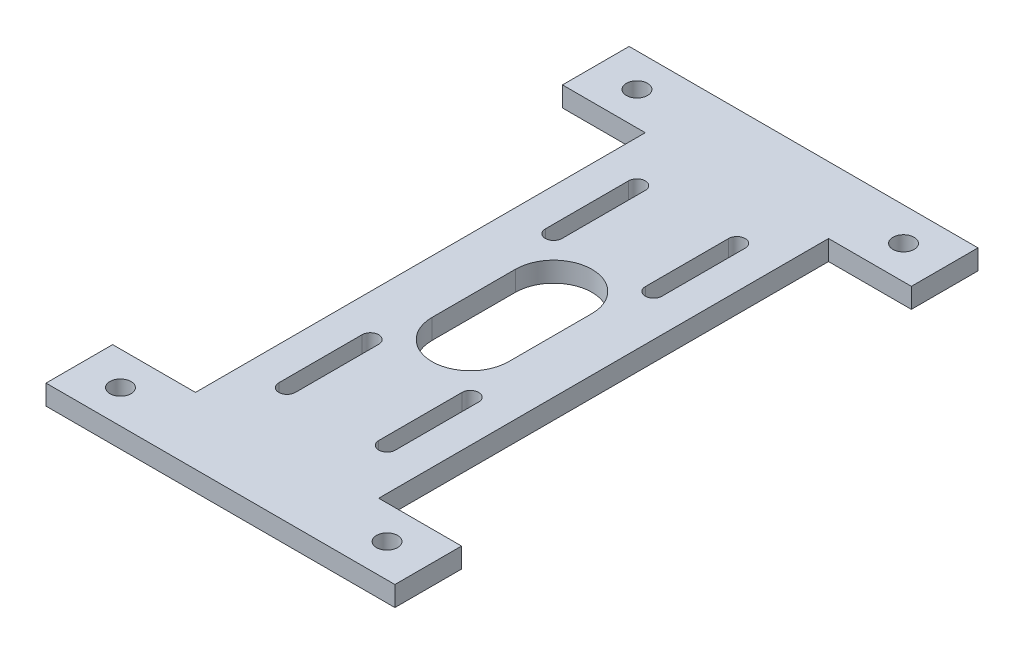
from build123d import *

# Parameters (mm, degrees)
SKETCH1_R           = 3.175
BOSS_EXTRUDE1_DEPTH = 6
SKETCH2_R           = 6
CUT_EXTRUDE1_DEPTH  = 1.5


with BuildPart() as part:
    # Sketch1 → Boss-Extrude1 (new body)
    with BuildSketch(Plane(origin=(0, 0, 0), x_dir=(1, 0, 0), z_dir=(0, 1, 0))):
        Polygon((-52.3534233, 67.5), (-27.5, 67.5), (-27.5, -67.5), (-52.3534233, -67.5), (-52.3534233, -87.5), (52.3534233, -87.5), (52.3534233, -67.5), (27.5, -67.5), (27.5, 67.5), (52.3534233, 67.5), (52.3534233, 87.5), (-52.3534233, 87.5), align=None)
        with Locations((-40, 77.5)):
            Circle(SKETCH1_R, mode=Mode.SUBTRACT)
        with Locations((40, 77.5)):
            Circle(SKETCH1_R, mode=Mode.SUBTRACT)
        with BuildLine():
            Line((12.5, 27.5), (12.5, 52.5))
            ThreePointArc((12.5, 52.5), (15, 55), (17.5, 52.5))
            Line((17.5, 52.5), (17.5, 27.5))
            ThreePointArc((17.5, 27.5), (15, 25), (12.5, 27.5))
        make_face(mode=Mode.SUBTRACT)
        with BuildLine():
            ThreePointArc((-17.5, -27.5), (-15, -25), (-12.5, -27.5))
            Line((-12.5, -27.5), (-12.5, -52.5))
            ThreePointArc((-12.5, -52.5), (-15, -55), (-17.5, -52.5))
            Line((-17.5, -52.5), (-17.5, -27.5))
        make_face(mode=Mode.SUBTRACT)
        with BuildLine():
            Line((12.5, -52.5), (12.5, -27.5))
            ThreePointArc((12.5, -27.5), (15, -25), (17.5, -27.5))
            Line((17.5, -27.5), (17.5, -52.5))
            ThreePointArc((17.5, -52.5), (15, -55), (12.5, -52.5))
        make_face(mode=Mode.SUBTRACT)
        with BuildLine():
            ThreePointArc((11.5, -12.5), (0, -24), (-11.5, -12.5))
            Line((-11.5, -12.5), (-11.5, 12.5))
            ThreePointArc((-11.5, 12.5), (0, 24), (11.5, 12.5))
            Line((11.5, 12.5), (11.5, -12.5))
        make_face(mode=Mode.SUBTRACT)
        with BuildLine():
            Line((-12.5, 52.5), (-12.5, 27.5))
            ThreePointArc((-12.5, 27.5), (-15, 25), (-17.5, 27.5))
            Line((-17.5, 27.5), (-17.5, 52.5))
            ThreePointArc((-17.5, 52.5), (-15, 55), (-12.5, 52.5))
        make_face(mode=Mode.SUBTRACT)
        with Locations((40, -77.5)):
            Circle(SKETCH1_R, mode=Mode.SUBTRACT)
        with Locations((-40, -77.5)):
            Circle(SKETCH1_R, mode=Mode.SUBTRACT)
    extrude(amount=BOSS_EXTRUDE1_DEPTH)

    # Sketch2 → Cut-Extrude1 (cut)
    with BuildSketch(Plane(origin=(0, 0, 0), x_dir=(1, 0, 0), z_dir=(0, 1, 0))):
        with Locations((-40, 77.5)):
            Circle(SKETCH2_R)
        with Locations((40, 77.5)):
            Circle(SKETCH2_R)
        with Locations((40, -77.5)):
            Circle(SKETCH2_R)
        with Locations((-40, -77.5)):
            Circle(SKETCH2_R)
    extrude(amount=CUT_EXTRUDE1_DEPTH, mode=Mode.SUBTRACT)


solid = part.part
